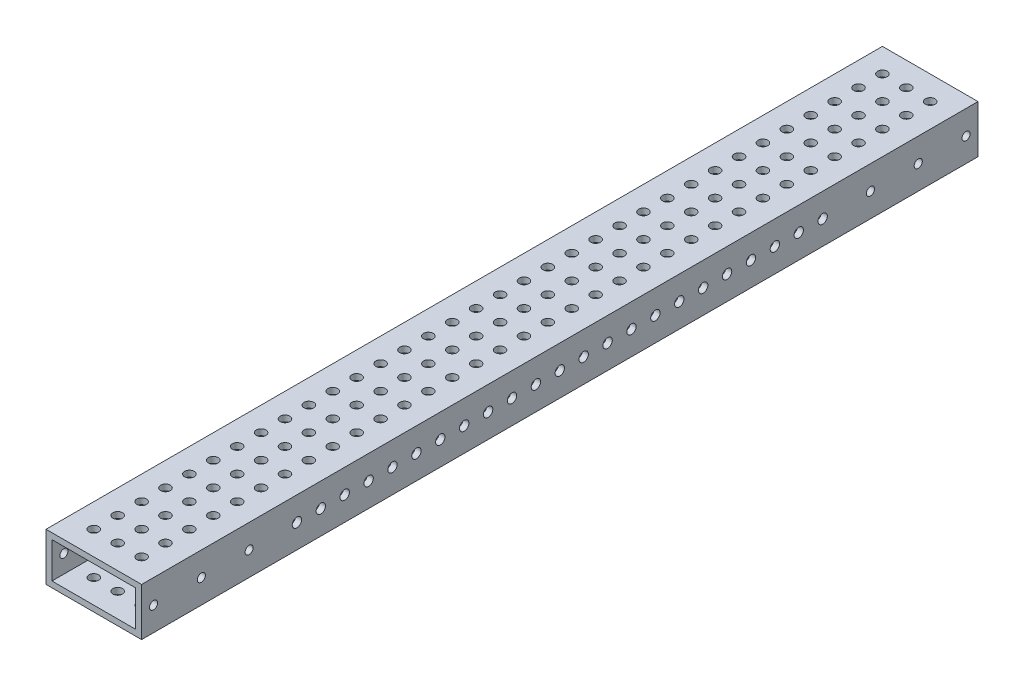
from build123d import *

# Parameters (mm, degrees)
SKETCH1_W           = 50.8
SKETCH1_H           = 25.4
SKETCH1_W_2         = 44.45
SKETCH1_H_2         = 19.05
BOSS_EXTRUDE1_DEPTH = 222.25
SKETCH2_R           = 2.5527
CUT_EXTRUDE1_DEPTH  = 226.134143346
SKETCH3_R           = 2.15265
SKETCH3_R_2         = 2.159
CUT_EXTRUDE2_DEPTH  = 229.335263374
SKETCH4_R           = 2.4892
CUT_EXTRUDE3_DEPTH  = 229.335263374


with BuildPart() as part:
    # Sketch1 → Boss-Extrude1 (new, symmetric)
    with BuildSketch(Plane.XY):
        Rectangle(SKETCH1_W, SKETCH1_H)
        Rectangle(SKETCH1_W_2, SKETCH1_H_2, mode=Mode.SUBTRACT)
    extrude(amount=BOSS_EXTRUDE1_DEPTH, both=True)

    # Sketch2 → Cut-Extrude1 (cut, through all)
    with BuildSketch(Plane(origin=(0, 12.7, 0), x_dir=(1, 0, 0), z_dir=(0, 1, 0))):
        with Locations((0, -209.55)):
            Circle(SKETCH2_R)
        with Locations((12.7, -209.55)):
            Circle(SKETCH2_R)
        with Locations((-12.7, -209.55)):
            Circle(SKETCH2_R)
        with Locations((-12.7, -196.85)):
            Circle(SKETCH2_R)
        with Locations((0, -196.85)):
            Circle(SKETCH2_R)
        with Locations((12.7, -196.85)):
            Circle(SKETCH2_R)
        with Locations((-12.7, -184.15)):
            Circle(SKETCH2_R)
        with Locations((0, -184.15)):
            Circle(SKETCH2_R)
        with Locations((12.7, -184.15)):
            Circle(SKETCH2_R)
        with Locations((-12.7, -171.45)):
            Circle(SKETCH2_R)
        with Locations((0, -171.45)):
            Circle(SKETCH2_R)
        with Locations((12.7, -171.45)):
            Circle(SKETCH2_R)
        with Locations((-12.7, -158.75)):
            Circle(SKETCH2_R)
        with Locations((0, -158.75)):
            Circle(SKETCH2_R)
        with Locations((12.7, -158.75)):
            Circle(SKETCH2_R)
        with Locations((-12.7, -146.05)):
            Circle(SKETCH2_R)
        with Locations((0, -146.05)):
            Circle(SKETCH2_R)
        with Locations((12.7, -146.05)):
            Circle(SKETCH2_R)
        with Locations((-12.7, -133.35)):
            Circle(SKETCH2_R)
        with Locations((0, -133.35)):
            Circle(SKETCH2_R)
        with Locations((12.7, -133.35)):
            Circle(SKETCH2_R)
        with Locations((-12.7, -120.65)):
            Circle(SKETCH2_R)
        with Locations((0, -120.65)):
            Circle(SKETCH2_R)
        with Locations((12.7, -120.65)):
            Circle(SKETCH2_R)
        with Locations((-12.7, -107.95)):
            Circle(SKETCH2_R)
        with Locations((0, -107.95)):
            Circle(SKETCH2_R)
        with Locations((12.7, -107.95)):
            Circle(SKETCH2_R)
        with Locations((-12.7, -95.25)):
            Circle(SKETCH2_R)
        with Locations((0, -95.25)):
            Circle(SKETCH2_R)
        with Locations((12.7, -95.25)):
            Circle(SKETCH2_R)
        with Locations((-12.7, -82.55)):
            Circle(SKETCH2_R)
        with Locations((0, -82.55)):
            Circle(SKETCH2_R)
        with Locations((12.7, -82.55)):
            Circle(SKETCH2_R)
        with Locations((-12.7, -69.85)):
            Circle(SKETCH2_R)
        with Locations((0, -69.85)):
            Circle(SKETCH2_R)
        with Locations((12.7, -69.85)):
            Circle(SKETCH2_R)
        with Locations((-12.7, -57.15)):
            Circle(SKETCH2_R)
        with Locations((0, -57.15)):
            Circle(SKETCH2_R)
        with Locations((12.7, -57.15)):
            Circle(SKETCH2_R)
        with Locations((-12.7, -44.45)):
            Circle(SKETCH2_R)
        with Locations((0, -44.45)):
            Circle(SKETCH2_R)
        with Locations((12.7, -44.45)):
            Circle(SKETCH2_R)
        with Locations((-12.7, -31.75)):
            Circle(SKETCH2_R)
        with Locations((0, -31.75)):
            Circle(SKETCH2_R)
        with Locations((12.7, -31.75)):
            Circle(SKETCH2_R)
        with Locations((-12.7, -19.05)):
            Circle(SKETCH2_R)
        with Locations((0, -19.05)):
            Circle(SKETCH2_R)
        with Locations((12.7, -19.05)):
            Circle(SKETCH2_R)
        with Locations((-12.7, -6.35)):
            Circle(SKETCH2_R)
        with Locations((0, -6.35)):
            Circle(SKETCH2_R)
        with Locations((12.7, -6.35)):
            Circle(SKETCH2_R)
        with Locations((-12.7, 6.35)):
            Circle(SKETCH2_R)
        with Locations((0, 6.35)):
            Circle(SKETCH2_R)
        with Locations((12.7, 6.35)):
            Circle(SKETCH2_R)
        with Locations((-12.7, 19.05)):
            Circle(SKETCH2_R)
        with Locations((0, 19.05)):
            Circle(SKETCH2_R)
        with Locations((12.7, 19.05)):
            Circle(SKETCH2_R)
        with Locations((-12.7, 31.75)):
            Circle(SKETCH2_R)
        with Locations((0, 31.75)):
            Circle(SKETCH2_R)
        with Locations((12.7, 31.75)):
            Circle(SKETCH2_R)
        with Locations((-12.7, 44.45)):
            Circle(SKETCH2_R)
        with Locations((0, 44.45)):
            Circle(SKETCH2_R)
        with Locations((12.7, 44.45)):
            Circle(SKETCH2_R)
        with Locations((-12.7, 57.15)):
            Circle(SKETCH2_R)
        with Locations((0, 57.15)):
            Circle(SKETCH2_R)
        with Locations((12.7, 57.15)):
            Circle(SKETCH2_R)
        with Locations((-12.7, 69.85)):
            Circle(SKETCH2_R)
        with Locations((0, 69.85)):
            Circle(SKETCH2_R)
        with Locations((12.7, 69.85)):
            Circle(SKETCH2_R)
        with Locations((-12.7, 82.55)):
            Circle(SKETCH2_R)
        with Locations((0, 82.55)):
            Circle(SKETCH2_R)
        with Locations((12.7, 82.55)):
            Circle(SKETCH2_R)
        with Locations((-12.7, 95.25)):
            Circle(SKETCH2_R)
        with Locations((0, 95.25)):
            Circle(SKETCH2_R)
        with Locations((12.7, 95.25)):
            Circle(SKETCH2_R)
        with Locations((-12.7, 107.95)):
            Circle(SKETCH2_R)
        with Locations((0, 107.95)):
            Circle(SKETCH2_R)
        with Locations((12.7, 107.95)):
            Circle(SKETCH2_R)
        with Locations((-12.7, 120.65)):
            Circle(SKETCH2_R)
        with Locations((0, 120.65)):
            Circle(SKETCH2_R)
        with Locations((12.7, 120.65)):
            Circle(SKETCH2_R)
        with Locations((-12.7, 133.35)):
            Circle(SKETCH2_R)
        with Locations((0, 133.35)):
            Circle(SKETCH2_R)
        with Locations((12.7, 133.35)):
            Circle(SKETCH2_R)
        with Locations((-12.7, 146.05)):
            Circle(SKETCH2_R)
        with Locations((0, 146.05)):
            Circle(SKETCH2_R)
        with Locations((12.7, 146.05)):
            Circle(SKETCH2_R)
        with Locations((-12.7, 158.75)):
            Circle(SKETCH2_R)
        with Locations((0, 158.75)):
            Circle(SKETCH2_R)
        with Locations((12.7, 158.75)):
            Circle(SKETCH2_R)
        with Locations((-12.7, 171.45)):
            Circle(SKETCH2_R)
        with Locations((0, 171.45)):
            Circle(SKETCH2_R)
        with Locations((12.7, 171.45)):
            Circle(SKETCH2_R)
        with Locations((-12.7, 184.15)):
            Circle(SKETCH2_R)
        with Locations((0, 184.15)):
            Circle(SKETCH2_R)
        with Locations((12.7, 184.15)):
            Circle(SKETCH2_R)
        with Locations((-12.7, 196.85)):
            Circle(SKETCH2_R)
        with Locations((0, 196.85)):
            Circle(SKETCH2_R)
        with Locations((12.7, 196.85)):
            Circle(SKETCH2_R)
        with Locations((-12.7, 209.55)):
            Circle(SKETCH2_R)
        with Locations((0, 209.55)):
            Circle(SKETCH2_R)
        with Locations((12.7, 209.55)):
            Circle(SKETCH2_R)
    extrude(amount=-CUT_EXTRUDE1_DEPTH, mode=Mode.SUBTRACT)

    # Sketch3 → Cut-Extrude2 (cut, through all)
    with BuildSketch(Plane(origin=(25.4, 0, 0), x_dir=(0, 0, -1), z_dir=(1, 0, 0))):
        with Locations((-215.9, 0)):
            Circle(SKETCH3_R)
        with Locations((-190.5, 0)):
            Circle(SKETCH3_R)
        with Locations((-165.1, 0)):
            Circle(SKETCH3_R)
        with Locations((215.9, 0)):
            Circle(SKETCH3_R_2)
        with Locations((190.5, 0)):
            Circle(SKETCH3_R_2)
        with Locations((165.1, 0)):
            Circle(SKETCH3_R_2)
    extrude(amount=-CUT_EXTRUDE2_DEPTH, mode=Mode.SUBTRACT)

    # Sketch4 → Cut-Extrude3 (cut, through all)
    with BuildSketch(Plane(origin=(25.4, 0, 0), x_dir=(0, 0, -1), z_dir=(1, 0, 0))):
        with Locations((-139.7, 0)):
            Circle(SKETCH4_R)
        with Locations((-127, 0)):
            Circle(SKETCH4_R)
        with Locations((-114.3, 0)):
            Circle(SKETCH4_R)
        with Locations((-101.6, 0)):
            Circle(SKETCH4_R)
        with Locations((-88.9, 0)):
            Circle(SKETCH4_R)
        with Locations((-76.2, 0)):
            Circle(SKETCH4_R)
        with Locations((-63.5, 0)):
            Circle(SKETCH4_R)
        with Locations((-50.8, 0)):
            Circle(SKETCH4_R)
        with Locations((-38.1, 0)):
            Circle(SKETCH4_R)
        with Locations((-25.4, 0)):
            Circle(SKETCH4_R)
        with Locations((-12.7, 0)):
            Circle(SKETCH4_R)
        Circle(SKETCH4_R)
        with Locations((12.7, 0)):
            Circle(SKETCH4_R)
        with Locations((25.4, 0)):
            Circle(SKETCH4_R)
        with Locations((38.1, 0)):
            Circle(SKETCH4_R)
        with Locations((50.8, 0)):
            Circle(SKETCH4_R)
        with Locations((63.5, 0)):
            Circle(SKETCH4_R)
        with Locations((76.2, 0)):
            Circle(SKETCH4_R)
        with Locations((88.9, 0)):
            Circle(SKETCH4_R)
        with Locations((101.6, 0)):
            Circle(SKETCH4_R)
        with Locations((114.3, 0)):
            Circle(SKETCH4_R)
        with Locations((127, 0)):
            Circle(SKETCH4_R)
        with Locations((139.7, 0)):
            Circle(SKETCH4_R)
    extrude(amount=-CUT_EXTRUDE3_DEPTH, mode=Mode.SUBTRACT)


solid = part.part
